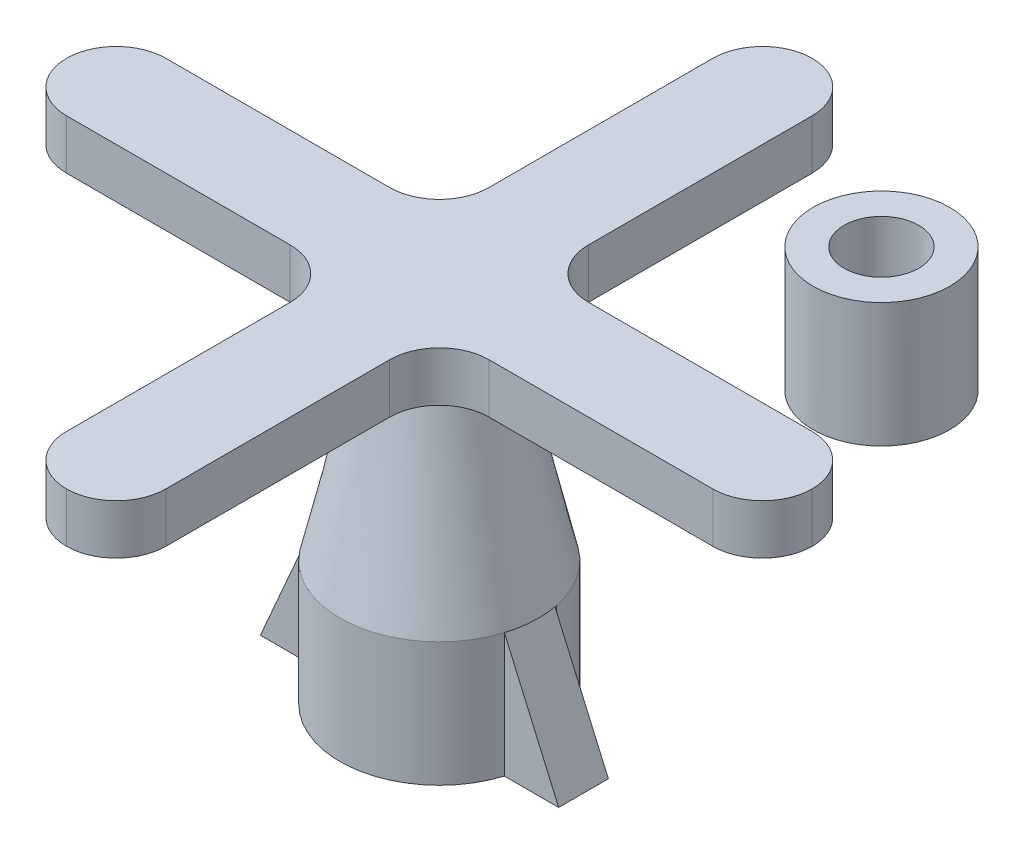
from build123d import *

# Parameters (mm, degrees)
SKETCH_1_R          = 2
EXTRUDE_2_DEPTH     = 10
SKETCH_4_R          = 1
CUT_EXTRUDE_1_DEPTH = 1.5
SKETCH_5_R          = 2.5500000000000007
CUT_EXTRUDE_2_DEPTH = 1.5
OTHER_4_OUTLINE_R   = 2.55
OTHER_4_DEPTH       = 1.5
SKETCH_9_R          = 4
SKETCH_9_R_2        = 2.5500000000000003
EXTRUDE_3_DEPTH     = 5
SKETCH_11_W         = 3.45
SKETCH_11_H         = 2
EXTRUDE_4_DEPTH     = 5
SKETCH_13_R         = 2.5499999999999994
SKETCH_13_R_2       = 1.3600000000000005
EXTRUDE_6_DEPTH     = 5
SKETCH_14_R         = 2.75
CUT_EXTRUDE_3_DEPTH = 5
SKETCH_17_R         = 1
CUT_EXTRUDE_4_DEPTH = 8
SKETCH_18_R         = 1.5000000000000004
CUT_EXTRUDE_5_DEPTH = 8
SKETCH_19_R         = 2.7499999999999982
SKETCH_19_R_2       = 2.549999999999999
EXTRUDE_7_DEPTH     = 5
SWEEP_4_DEPTH       = 1.199370755
EXTRUDE_8_DEPTH     = 2
SKETCH_26_W         = 30
SKETCH_26_H         = 4
EXTRUDE_9_DEPTH     = 2
FILLET_3_R          = 2
FILLET_4_R          = 2
SKETCH_28_R         = 2.7499999999999982
SKETCH_28_R_2       = 1.5000000000000002
EXTRUDE_10_DEPTH    = 10
SKETCH_29_R         = 2.749999999999998
SKETCH_29_R_2       = 1.5000000000000002
CUT_EXTRUDE_6_DEPTH = 5
SKETCH_30_R         = 3.4440131177468327
CUT_EXTRUDE_7_DEPTH = 5
FILLET_5_R          = 2
SKETCH_31_R         = 32.078168180335766
EXTRUDE_11_DEPTH    = 5
CUT_EXTRUDE_START   = -5
SKETCH_32_R         = 32.078168180335766
CUT_EXTRUDE_8_DEPTH = 5


with BuildPart() as part:
    # 草图1 → 凸台-拉伸2 (new body)
    with BuildSketch(Plane(origin=(0, 0, 0), x_dir=(1, 0, 0), z_dir=(0, 1, 0))):
        with Locations(Location((0, 0, 0), (0, 0, 270))):
            Circle(SKETCH_1_R)
    extrude(amount=EXTRUDE_2_DEPTH)

    # 放样1: read off the stored shape, not the designer's step
    # 放样1: loft between two sections, ruled curve by curve
    loft_1_from = [
        Edge.make_bspline([(3.527981201, 0, 1.885032797), (7.298046794, 0, -5.170929606), (0.242084392, 0, -8.940995199), (-3.527981201, 0, -1.885032797), (-7.298046794, 0, 5.170929606), (-0.242084392, 0, 8.940995199), (3.527981201, 0, 1.885032797)], [0, 0, 0, 0, 0.5, 0.5, 0.5, 1, 1, 1, 1], 3, [1, 0.333333333333333, 0.333333333333333, 1, 0.333333333333333, 0.333333333333333, 1]),
    ]
    loft_1_to = [
        Edge.make_bspline([(1.985312696, 10, -0.241936974), (1.501438748, 10, -4.212562366), (-2.469186644, 10, -3.728688418), (-1.985312696, 10, 0.241936974), (-1.501438748, 10, 4.212562366), (2.469186644, 10, 3.728688418), (1.985312696, 10, -0.241936974)], [0, 0, 0, 0, 0.5, 0.5, 0.5, 1, 1, 1, 1], 3, [1, 0.333333333333333, 0.333333333333333, 1, 0.333333333333333, 0.333333333333333, 1]),
    ]
    loft_1 = Solid(Shell([*[Face.make_surface_from_curves(loft_1_from[k], loft_1_to[k]) for k in range(1)], Face(Wire(loft_1_from)), Face(Wire(loft_1_to))]))
    add(loft_1)

    # 草图4 → 切除-拉伸1 (cut)
    with BuildSketch(Plane.XZ):
        with Locations(Location((0, 0, 0), (0, 0, 270))):
            Circle(SKETCH_4_R)
    extrude(amount=-CUT_EXTRUDE_1_DEPTH, mode=Mode.SUBTRACT)

    # 草图5 → 切除-拉伸2 (cut)
    with BuildSketch(Plane.XZ):
        with Locations(Location((0, 0, 0), (0, 0, 270))):
            Circle(SKETCH_5_R)
    extrude(amount=-CUT_EXTRUDE_2_DEPTH, mode=Mode.SUBTRACT)

    # 边界4: read off the stored shape, not the designer's step
    # 边界4 outline → 边界4 (add)
    with BuildSketch(Plane(origin=(0, 0, 0), x_dir=(1, 0, 0), z_dir=(0, 1, 0))):
        Circle(OTHER_4_OUTLINE_R)
    extrude(amount=OTHER_4_DEPTH)

    # 切除-扫描1: sweep along a path in 草图7
    with BuildLine(Plane.XZ) as sweep_1_path:
        CenterArc((0, 0), 2.5500000000000003, 0, 360)
    # 草图8 → 切除-扫描1 (sweep, cut)
    with BuildSketch(Plane.XY):
        with BuildLine():
            Line((0, 1.5), (0, 0))
            Line((0, 0), (2.55, 0))
            add(Edge.make_bspline(
                [(2.55, 0), (2.066182344596684, 1.6092270378331606), (0, 1.5)],
                knots=[0, 0, 0, 1, 1, 1], degree=2))
        make_face()
    sweep(path=sweep_1_path.line, mode=Mode.SUBTRACT)

    # 草图9 → 凸台-拉伸3 (add)
    with BuildSketch(Plane.XZ):
        with Locations(Location((0, 0, 0), (0, 0, 28.116))):
            Circle(SKETCH_9_R)
        with Locations(Location((0, 0, 0), (0, 0, 90))):
            Circle(SKETCH_9_R_2, mode=Mode.SUBTRACT)
    extrude(amount=EXTRUDE_3_DEPTH)

    # 草图11 → 凸台-拉伸4 (add)
    with BuildSketch(Plane.XZ.offset(5)):
        Polygon((2.55, 1.199370755069412), (2.5500000000000003, -0.8006292449305884), (6, -0.8006292449305882), (6, 1.199370755069412), align=None)
        with Locations((-4.275, 0.19937075506941165)):
            Rectangle(SKETCH_11_W, SKETCH_11_H)
    extrude(amount=-EXTRUDE_4_DEPTH)

    # 草图14 → 切除-拉伸3 (cut)
    with BuildSketch(Plane.XZ.offset(5)):
        with Locations(Location((0, 0, 0), (0, 0, 270))):
            Circle(SKETCH_14_R)
    extrude(amount=-CUT_EXTRUDE_3_DEPTH, mode=Mode.SUBTRACT)

    # 切除-扫描2: sweep along a path in 草图16
    with BuildLine(Plane.XZ) as sweep_2_path:
        CenterArc((0, 0), 2.75, 0, 360)
    # 草图15 → 切除-扫描2 (sweep, cut)
    with BuildSketch(Plane.XY):
        with BuildLine():
            Line((0, 0), (2.75, 0))
            add(Edge.make_bspline(
                [(2.75, 0), (2.6198492058143814, 1.7714522282796645), (0, 1.6)],
                knots=[0, 0, 0, 1, 1, 1], degree=2))
            Line((0, 1.6), (0, 0))
        make_face()
    sweep(path=sweep_2_path.line, mode=Mode.SUBTRACT)

    # 草图17 → 切除-拉伸4 (cut)
    with BuildSketch(Plane(origin=(0, 10, 0), x_dir=(1, 0, 0), z_dir=(0, 1, 0))):
        with Locations(Location((0, 0, 0), (0, 0, 270))):
            Circle(SKETCH_17_R)
    extrude(amount=-CUT_EXTRUDE_4_DEPTH, mode=Mode.SUBTRACT)

    # 切除-扫描4: read off the stored shape, not the designer's step
    # 切除-扫描4 outline → 切除-扫描4 (cut)
    with BuildSketch(Plane.XY):
        Polygon((6, 0), (3.815954637, 0), (6, -5), align=None)
        Polygon((-3.815954637, 0), (-6, 0), (-6, -5), align=None)
    extrude(amount=SWEEP_4_DEPTH, mode=Mode.SUBTRACT)

    # 切除-扫描5: sweep along a path in 草图24
    with BuildLine(Plane(origin=(6, 0, 0), x_dir=(0, 0, -1), z_dir=(1, 0, 0))) as sweep_5_path:
        Line((0, -5), (0.8006292449305882, -5))
    # 草图23 → 切除-扫描5 (sweep, cut)
    with BuildSketch(Plane.XY):
        Polygon((3.8159546370317634, 0), (6, 0), (6, -5), align=None)
        Polygon((-3.8159546370317634, 0), (-6, -5), (-6, 0), align=None)
    sweep(path=sweep_5_path.line, mode=Mode.SUBTRACT)

    # 草图25 → 凸台-拉伸8 (add)
    with BuildSketch(Plane(origin=(0, 10, 0), x_dir=(1, 0, 0), z_dir=(0, 1, 0))):
        Polygon((-2.0000000000000027, 15.000000000000004), (1.9999999999999973, 15.000000000000004), (2.000000000000001, -14.999999999999996), (-1.9999999999999991, -14.999999999999996), align=None)
    extrude(amount=-EXTRUDE_8_DEPTH)

    # 草图26 → 凸台-拉伸9 (add)
    with BuildSketch(Plane(origin=(0, 10, 0), x_dir=(1, 0, 0), z_dir=(0, 1, 0))):
        Rectangle(SKETCH_26_W, SKETCH_26_H)
    extrude(amount=-EXTRUDE_9_DEPTH)

    # 圆角3
    fillet_3_edges = [part.edges().sort_by_distance(p)[0] for p in [
        (-2.000000000000001, 9, 2),
    ]]
    fillet(fillet_3_edges, radius=FILLET_3_R)

    # 圆角4
    fillet_4_edges = [part.edges().sort_by_distance(p)[0] for p in [
        (1.9999999999999987, 9, 2),
        (-2.0000000000000018, 9, -1.9999999999999998),
        (1.9999999999999987, 9, -1.9999999999999998),
    ]]
    fillet(fillet_4_edges, radius=FILLET_4_R)

    # 圆角5
    fillet_5_edges = [part.edges().sort_by_distance(p)[0] for p in [
        (1.9999999999999973, 9, -15.000000000000004),
        (-2.0000000000000027, 9, -15.000000000000004),
        (-14.999999999999998, 9, -1.9999999999999996),
        (-14.999999999999998, 9, 2.0000000000000004),
        (-1.9999999999999991, 9, 14.999999999999996),
        (2.000000000000001, 9, 14.999999999999996),
        (15.000000000000002, 9, 2.0000000000000004),
        (15.000000000000002, 9, -1.9999999999999996),
    ]]
    fillet(fillet_5_edges, radius=FILLET_5_R - 0.0001)  # a hair under: the kernel refuses the full size



with BuildPart() as body_2:
    # 草图13 → 凸台-拉伸6 (new body)
    with BuildSketch(Plane.XZ.offset(5)):
        with Locations(Location((13.780391227088217, 0, 0), (0, 0, 270))):
            Circle(SKETCH_13_R)
        with Locations(Location((13.780391227088217, 0, 0), (0, 0, 270))):
            Circle(SKETCH_13_R_2, mode=Mode.SUBTRACT)
    extrude(amount=-EXTRUDE_6_DEPTH)

    # 草图18 → 切除-拉伸5 (cut)
    with BuildSketch(Plane.XZ.offset(5)):
        with Locations(Location((13.780391227088217, 0, 0), (0, 0, 270))):
            Circle(SKETCH_18_R)
    extrude(amount=-CUT_EXTRUDE_5_DEPTH, mode=Mode.SUBTRACT)

    # 草图19 → 凸台-拉伸7 (add)
    with BuildSketch(Plane.XZ.offset(5)):
        with Locations(Location((13.780391227088217, 0, 0), (0, 0, 270))):
            Circle(SKETCH_19_R)
        with Locations((13.780391227088217, 0)):
            Circle(SKETCH_19_R_2, mode=Mode.SUBTRACT)
    extrude(amount=-EXTRUDE_7_DEPTH)

    # 草图30 → 切除-拉伸7 (cut)
    with BuildSketch(Plane.XZ.offset(5)):
        with Locations((13.780391227088217, 0)):
            Circle(SKETCH_30_R)
    extrude(amount=-CUT_EXTRUDE_7_DEPTH, mode=Mode.SUBTRACT)


with BuildPart() as body_3:
    # 草图28 → 凸台-拉伸10 (new body)
    with BuildSketch(Plane(origin=(0, 0, 0), x_dir=(1, 0, 0), z_dir=(0, 1, 0))):
        with Locations(Location((7.958455223865325, 9.826506431956656, 0), (0, 0, 270))):
            Circle(SKETCH_28_R)
        with Locations(Location((7.958455223865325, 9.826506431956656, 0), (0, 0, 270))):
            Circle(SKETCH_28_R_2, mode=Mode.SUBTRACT)
    extrude(amount=EXTRUDE_10_DEPTH)

    # 草图29 → 切除-拉伸6 (cut)
    with BuildSketch(Plane.XZ):
        with Locations(Location((7.958455223865325, -9.826506431956656, 0), (0, 0, 270))):
            Circle(SKETCH_29_R)
        with Locations(Location((7.958455223865325, -9.826506431956656, 0), (0, 0, 270))):
            Circle(SKETCH_29_R_2, mode=Mode.SUBTRACT)
    extrude(amount=-CUT_EXTRUDE_6_DEPTH, mode=Mode.SUBTRACT)


with BuildPart() as part_1:
    add(part.part)

    add(body_3.part)  # 凸台-拉伸11 merges body 3
    # 草图31 → 凸台-拉伸11 (add)
    with BuildSketch(Plane(origin=(0, 10, 0), x_dir=(1, 0, 0), z_dir=(0, 1, 0))):
        with Locations(Location((22.852661554417406, 23.157739017835205, 0), (0, 0, 218.644756535))):
            Circle(SKETCH_31_R)
    extrude(amount=EXTRUDE_11_DEPTH)

    # 草图32 → 切除-拉伸8 (cut)
    with BuildSketch(Plane(origin=(0, 15, 0), x_dir=(1, 0, 0), z_dir=(0, 1, 0)).offset(CUT_EXTRUDE_START)):
        with Locations((22.852661554417406, 23.157739017835205)):
            Circle(SKETCH_32_R)
    extrude(amount=CUT_EXTRUDE_8_DEPTH, mode=Mode.SUBTRACT)


with BuildPart() as cut_extrude_8_piece_1:
    # of the separate pieces the step leaves, piece 1, a body of its own (cut_extrude_8_pieces)
    add(part_1.part.solids().sort_by_distance((2, 8, 13.0001))[0])


with BuildPart() as cut_extrude_8_piece_2:
    # of the separate pieces the step leaves, piece 2, a body of its own (cut_extrude_8_pieces)
    add(part_1.part.solids().sort_by_distance((7.958455224, 5, -7.076506432))[0])


solid = Compound([cut_extrude_8_piece_1.part, cut_extrude_8_piece_2.part])
